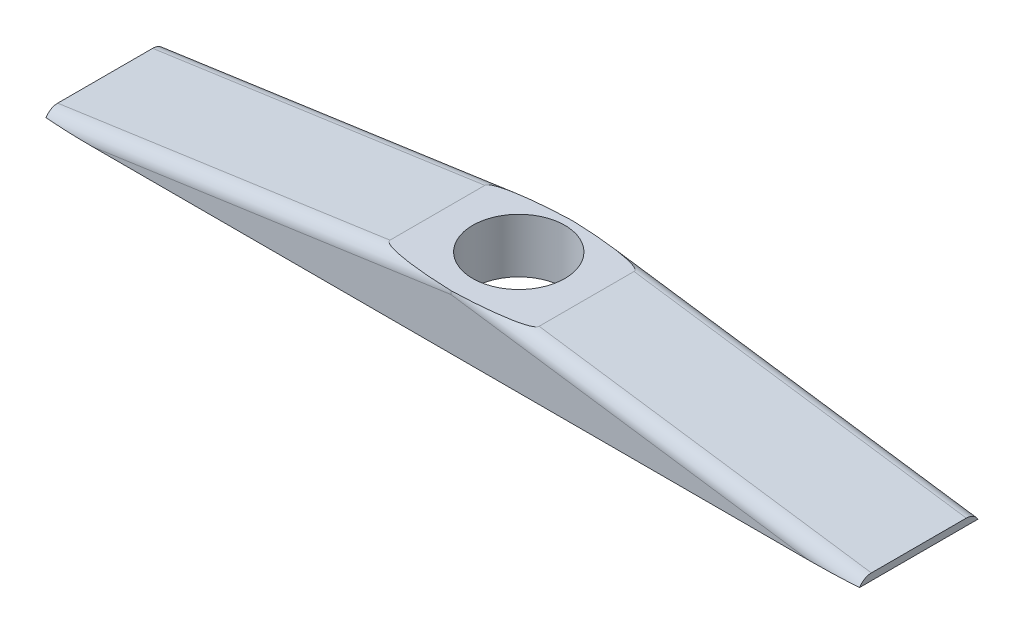
from build123d import *

# Parameters (mm, degrees)
BOSS_EXTRUDE1_DEPTH = 9
SKETCH2_R           = 3.4
CUT_EXTRUDE1_DEPTH  = 32.575306808
FILLET1_R           = 1


with BuildPart() as part:
    # Sketch1 → Boss-Extrude1 (new body)
    with BuildSketch(Plane.XY):
        Polygon((-30, 0), (30, 0), (30, 0.5), (5.5, 4), (-5.5, 4), (-30, 0.5), align=None)
    extrude(amount=BOSS_EXTRUDE1_DEPTH)

    # Sketch2 → Cut-Extrude1 (cut, through all)
    with BuildSketch(Plane(origin=(0, 4, 0), x_dir=(1, 0, 0), z_dir=(0, 1, 0))):
        with Locations(Location((0, -4, 0), (0, 0, 270))):
            Circle(SKETCH2_R)
    extrude(amount=-CUT_EXTRUDE1_DEPTH, mode=Mode.SUBTRACT)

    # Fillet1
    # the kernel refuses this fillet: 1 mm, written as the material it takes off along each edge
    with BuildSketch(Plane(origin=(0.439696962, 4.848528137, 9), x_dir=(0.1414213562373095, -0.9899494936611666, 0), z_dir=(-0.9899494936611666, -0.1414213562373095, 0)), Plane(origin=(35.939696962, -0.348528137, 9), x_dir=(-0.14142135623730948, -0.9899494936611666, 0), z_dir=(-0.9899494936611666, 0.1414213562373095, 0))) as fillet1_piece_1:
        with BuildLine():
            CenterArc((FILLET1_R, -FILLET1_R), FILLET1_R, 90, 90)
            Line((0, -FILLET1_R), (-FILLET1_R * 0.02, -FILLET1_R))
            Line((-FILLET1_R * 0.02, -FILLET1_R), (-FILLET1_R * 0.02, FILLET1_R * 0.02))
            Line((-FILLET1_R * 0.02, FILLET1_R * 0.02), (FILLET1_R, FILLET1_R * 0.02))
            Line((FILLET1_R, FILLET1_R * 0.02), (FILLET1_R, 0))
        make_face()
    extrude(amount=36.748737342, mode=Mode.SUBTRACT)
    with BuildSketch(Plane(origin=(0.439696962, 4.848528137, 0), x_dir=(0.1414213562373095, -0.9899494936611666, 0), z_dir=(-0.9899494936611666, -0.1414213562373095, 0)), Plane(origin=(35.939696962, -0.348528137, 0), x_dir=(-0.14142135623730948, -0.9899494936611666, 0), z_dir=(-0.9899494936611666, 0.1414213562373095, 0))) as fillet1_piece_2:
        with BuildLine():
            CenterArc((FILLET1_R, FILLET1_R), FILLET1_R, 180, 90)
            Line((0, FILLET1_R), (-FILLET1_R * 0.02, FILLET1_R))
            Line((-FILLET1_R * 0.02, FILLET1_R), (-FILLET1_R * 0.02, -FILLET1_R * 0.02))
            Line((-FILLET1_R * 0.02, -FILLET1_R * 0.02), (FILLET1_R, -FILLET1_R * 0.02))
            Line((FILLET1_R, -FILLET1_R * 0.02), (FILLET1_R, 0))
        make_face()
    extrude(amount=36.748737342, mode=Mode.SUBTRACT)


solid = part.part
